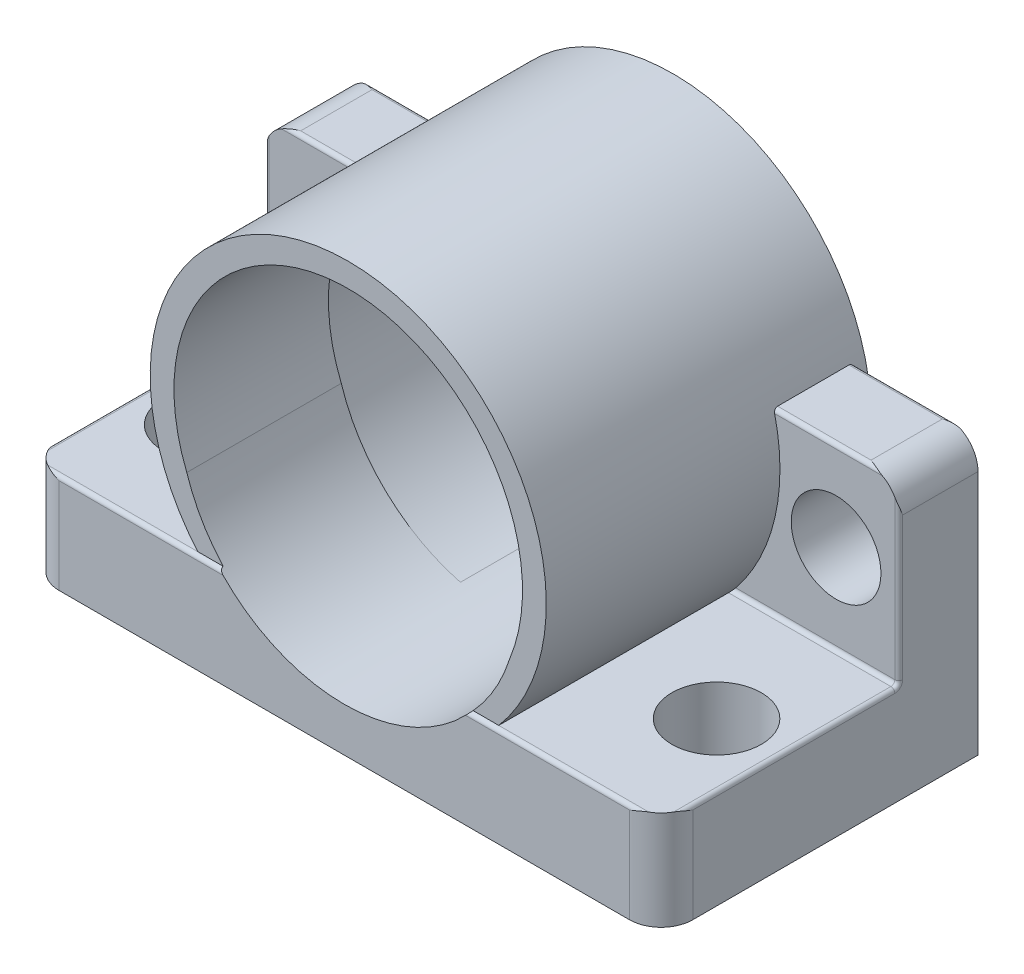
from build123d import *

# Parameters (mm, degrees)
SKETCH1_W                = 160
SKETCH1_H                = 80
BOSS_EXTRUDE1_DEPTH      = 25
SKETCH2_W                = 42
SKETCH2_H                = 20
BOSS_EXTRUDE2_DEPTH      = 45
FILLET1_R                = 1
EXTRUDE_THIN2_DEPTH      = 39
EXTRUDE_THIN2_DEPTH_BACK = 43
SKETCH6_R                = 50
SKETCH6_R_2              = 44
CUT_EXTRUDE2_DEPTH       = 51
CUT_EXTRUDE2_DEPTH_BACK  = 39
SKETCH7_R                = 42.763931037
SKETCH9_R                = 11.330275353
CUT_EXTRUDE4_DEPTH       = 141.731126785
SKETCH10_R               = 11.3
CUT_EXTRUDE5_DEPTH       = 123.699837168
FILLET4_R                = 8
SKETCH12_R               = 45.160812279
CUT_EXTRUDE10_DEPTH      = 141.731126785


with BuildPart() as part:
    # Sketch1 → Boss-Extrude1 (new body)
    with BuildSketch(Plane(origin=(0, 0, 0), x_dir=(1, 0, 0), z_dir=(0, 1, 0))):
        Rectangle(SKETCH1_W, SKETCH1_H)
    extrude(amount=BOSS_EXTRUDE1_DEPTH)

    # Sketch2 → Boss-Extrude2 (add)
    with BuildSketch(Plane(origin=(0, 25, 0), x_dir=(1, 0, 0), z_dir=(0, 1, 0))):
        with Locations((-59, 30)):
            Rectangle(SKETCH2_W, SKETCH2_H)
        with Locations((59, 30)):
            Rectangle(SKETCH2_W, SKETCH2_H)
    extrude(amount=BOSS_EXTRUDE2_DEPTH)

    # Fillet1
    fillet1_edges = [part.edges().sort_by_distance(p)[0] for p in [
        (-80, 25, 10),
        (-59, 25, -20),
        (-80, 47.5, -20),
        (0, 25, 40),
        (-59, 70, -20),
        (-59, 70, -40),
        (59, 70, -20),
        (80, 47.5, -20),
        (59, 70, -40),
        (59, 25, -20),
        (80, 25, 10),
        (-80, 0, 0),
        (-80, 35, -40),
    ]]
    fillet(fillet1_edges, radius=FILLET1_R)

    # Sketch6 → Extrude-Thin2 (add, two sides: drawn at the far end of the back side and taken through both)
    with BuildSketch(Plane.XY.offset(-EXTRUDE_THIN2_DEPTH_BACK)):
        with Locations((0, 57.5)):
            Circle(SKETCH6_R)
        with Locations((0, 57.5)):
            Circle(SKETCH6_R_2, mode=Mode.SUBTRACT)
    extrude(amount=EXTRUDE_THIN2_DEPTH + EXTRUDE_THIN2_DEPTH_BACK)

    # Sketch7 → Cut-Extrude2 (cut, two sides: drawn at the far end of the back side and taken through both)
    with BuildSketch(Plane.XY.offset(-CUT_EXTRUDE2_DEPTH_BACK)):
        with Locations((0, 53.868306457)):
            Circle(SKETCH7_R)
    extrude(amount=CUT_EXTRUDE2_DEPTH + CUT_EXTRUDE2_DEPTH_BACK, mode=Mode.SUBTRACT)

    # Sketch9 → Cut-Extrude4 (cut, through all)
    with BuildSketch(Plane.XY):
        with Locations((-63.82976572, 47.5)):
            Circle(SKETCH9_R)
        with Locations((64.17023428, 47.5)):
            Circle(SKETCH9_R)
    extrude(amount=-CUT_EXTRUDE4_DEPTH, mode=Mode.SUBTRACT)

    # Sketch10 → Cut-Extrude5 (cut, through all)
    with BuildSketch(Plane(origin=(0, 25, 0), x_dir=(1, 0, 0), z_dir=(0, 1, 0))):
        with Locations(Location((-64.5, -10, 0), (0, 0, 270))):
            Circle(SKETCH10_R)
        with Locations(Location((64, -10, 0), (0, 0, 270))):
            Circle(SKETCH10_R)
    extrude(amount=-CUT_EXTRUDE5_DEPTH, mode=Mode.SUBTRACT)

    # Fillet4
    # the kernel refuses this fillet: 8 mm, written as the material it takes off along each edge
    with BuildSketch(Plane(origin=(80, -20, 40), x_dir=(-1, 0, 0), z_dir=(0, 1, 0))) as fillet4_piece_1:
        with BuildLine():
            CenterArc((FILLET4_R, -FILLET4_R), FILLET4_R, 90, 90)
            Line((0, -FILLET4_R), (0, 0))
            Line((0, 0), (FILLET4_R, 0))
        make_face()
    extrude(amount=64, mode=Mode.SUBTRACT)
    with BuildSketch(Plane(origin=(-80, -19, 40), x_dir=(1, 0, 0), z_dir=(0, 1, 0))) as fillet4_piece_2:
        with BuildLine():
            CenterArc((FILLET4_R, FILLET4_R), FILLET4_R, 180, 90)
            Line((0, FILLET4_R), (0, 0))
            Line((0, 0), (FILLET4_R, 0))
        make_face()
    extrude(amount=63, mode=Mode.SUBTRACT)
    with BuildSketch(Plane(origin=(80, 70, -1), x_dir=(0, -1, 0), z_dir=(0, 0, -1)), Plane(origin=(-80, 70, -59), x_dir=(0, -1, 0), z_dir=(0, 0, 1))) as fillet4_piece_3:
        with BuildLine():
            CenterArc((FILLET4_R, FILLET4_R), FILLET4_R, 180, 90)
            Line((0, FILLET4_R), (0, 0))
            Line((0, 0), (FILLET4_R, 0))
        make_face()
    extrude(amount=58, mode=Mode.SUBTRACT)

    # Sketch12 → Cut-Extrude10 (cut, through all)
    with BuildSketch(Plane.XY):
        with Locations((0, 56.339187721)):
            Circle(SKETCH12_R)
    extrude(amount=-CUT_EXTRUDE10_DEPTH, mode=Mode.SUBTRACT)


solid = part.part
